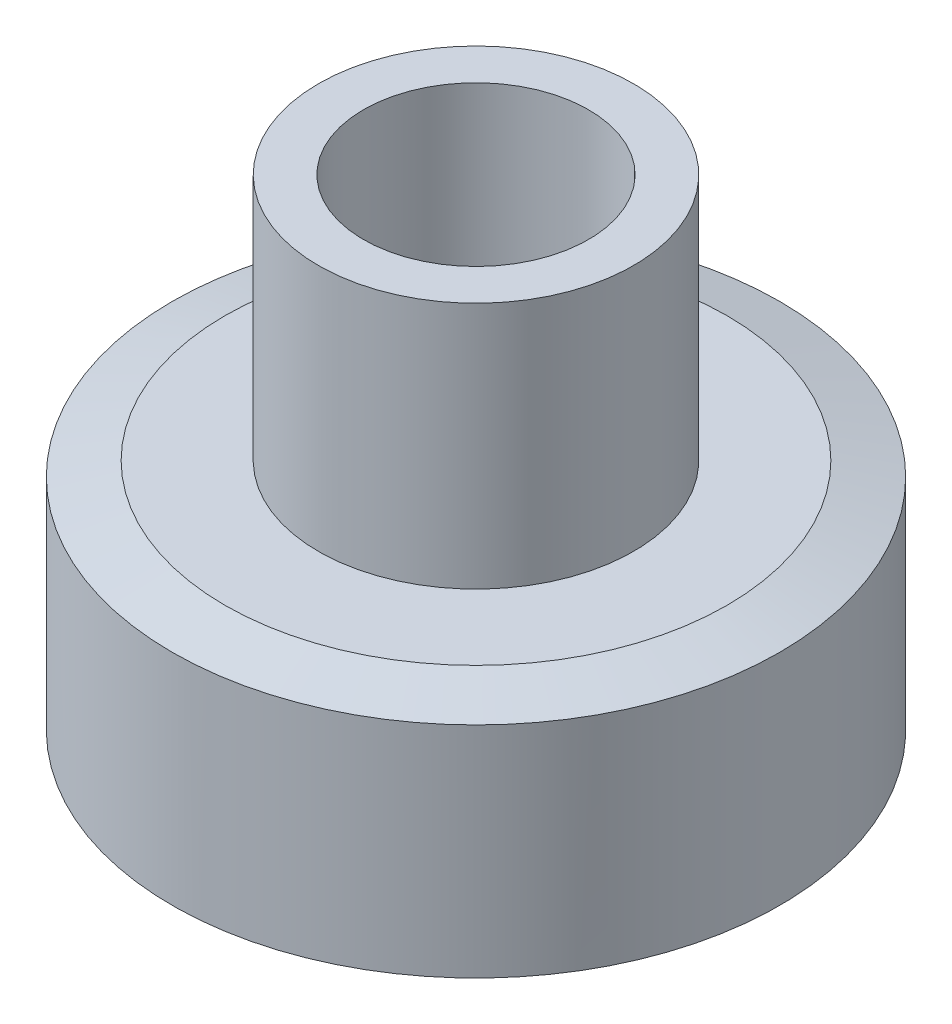
from build123d import *

# Parameters (mm, degrees)
CHAMFER_2_SIZE           = 1.175
CHAMFER_2_SIZE2          = 0.314840301
CHAMFER_3_SIZE           = 1.175
CHAMFER_3_SIZE2          = 0.314840301
CUT_EXTRUDE_2_DEPTH      = 15.564511664
CUT_EXTRUDE_2_DEPTH_BACK = 15.564511664
SKETCH_4_R               = 2.5


with BuildPart() as part:
    # Эскиз2 → Повернуть2 (revolve)
    with BuildSketch(Plane.XY):
        Polygon((0, 0), (6.75, 0), (6.75, 5.5), (3.5, 5.5), (3.5, 11), (0, 11), align=None)
    revolve(axis=Axis((0, 11, 0), (0, -1, 0)))

    # Фаска2
    chamfer_2_edges = [part.edges().sort_by_distance(p)[0] for p in [
        (-6.75, 5.5, 0),
    ]]
    chamfer_2_side = [part.faces().sort_by_distance(p)[0] for p in [
        (-6.559081169, 5.5, 0),
    ]]
    chamfer(chamfer_2_edges, length=CHAMFER_2_SIZE, length2=CHAMFER_2_SIZE2, reference=chamfer_2_side[0])

    # Фаска3
    chamfer_3_edges = [part.edges().sort_by_distance(p)[0] for p in [
        (-6.75, 0, 0),
    ]]
    chamfer_3_side = [part.faces().sort_by_distance(p)[0] for p in [
        (0, 0, 0),
    ]]
    chamfer(chamfer_3_edges, length=CHAMFER_3_SIZE, length2=CHAMFER_3_SIZE2, reference=chamfer_3_side[0])

    # Эскиз4 → Вырез-Вытянуть2 (cut, two sides: drawn at the far end of the back side and taken through both)
    with BuildSketch(Plane(origin=(0, 11, 0), x_dir=(1, 0, 0), z_dir=(0, 1, 0)).offset(-CUT_EXTRUDE_2_DEPTH_BACK)):
        Circle(SKETCH_4_R)
    extrude(amount=CUT_EXTRUDE_2_DEPTH + CUT_EXTRUDE_2_DEPTH_BACK, mode=Mode.SUBTRACT)


solid = part.part
